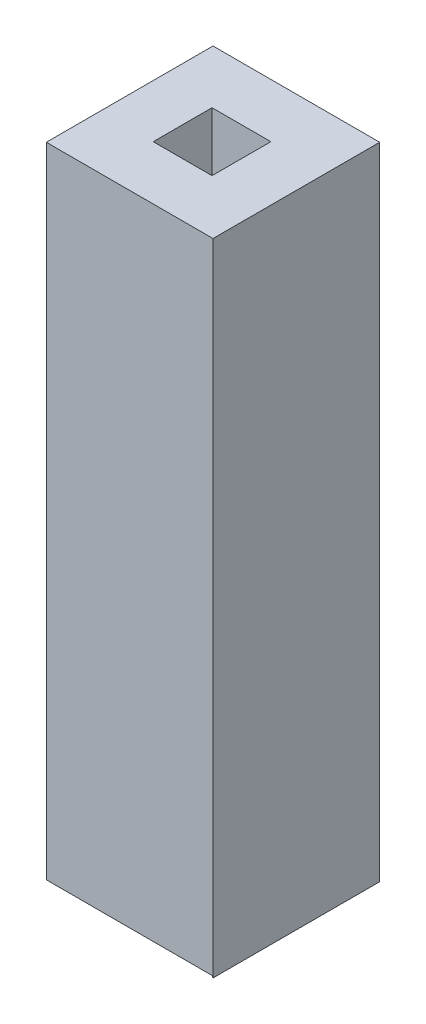
from build123d import *

# Parameters (mm, degrees)
SKETCH1_W           = 2.83333
SKETCH1_H           = 2.83333
BOSS_EXTRUDE2_DEPTH = 11
SKETCH2_W           = 1
SKETCH2_H           = 1
CUT_EXTRUDE1_DEPTH  = 11


with BuildPart() as part:
    # Sketch1 → Boss-Extrude2 (new body)
    with BuildSketch(Plane(origin=(0, 0, 0), x_dir=(1, 0, 0), z_dir=(0, 1, 0))):
        with Locations((1.416665, 1.416665)):
            Rectangle(SKETCH1_W, SKETCH1_H)
    extrude(amount=BOSS_EXTRUDE2_DEPTH)

    # Sketch2 → Cut-Extrude1 (cut)
    with BuildSketch(Plane(origin=(0, 0, 0), x_dir=(-1, 0, 0), z_dir=(0, -1, 0))):
        with Locations((-1.4, 1.416665)):
            Rectangle(SKETCH2_W, SKETCH2_H)
    extrude(amount=-CUT_EXTRUDE1_DEPTH, mode=Mode.SUBTRACT)

    # Chamfer5
    # the kernel refuses this chamfer: 1.732050808, 1 mm, written as the material it takes off along each edge
    with BuildSketch(Plane(origin=(1.9, 0, -0.916665), x_dir=(0, -0.05789386240267139, 0.9983227437537926), z_dir=(-1, 0, 0)), Plane(origin=(0.9, 0, -0.916665), x_dir=(-0.9983227437537926, -0.0578938624026714, 0), z_dir=(0, 0, -1)), Plane(origin=(0.9, 0, -1.916665), x_dir=(0, -0.05789386240267139, -0.9983227437537926), z_dir=(1, 0, 0)), Plane(origin=(1.9, 0, -1.916665), x_dir=(0.9983227437537926, -0.05789386240267139, 0), z_dir=(0, 0, 1))) as chamfer5_piece_1:
        with BuildLine():
            Line((1.03637929, 0), (-0.138331657, 1.787039577))
            Line((-0.138331657, 1.787039577), (-0.172914571, 1.785034075))
            ThreePointArc((-0.172914571, 1.785034075), (-0.086457286, 0.892517037), (-0.034582914, -0.002005502))
            Line((-0.034582914, -0.002005502), (0.002005502, -0.034582914))
            ThreePointArc((0.002005502, -0.034582914), (0.518458331, -0.004633232), (1.038384792, -0.034582914))
            Line((1.038384792, -0.034582914), (1.03637929, 0))
        make_face()
    extrude(amount=1, mode=Mode.SUBTRACT)
    with BuildSketch(Plane(origin=(1.9, 0, -1.916665), x_dir=(0.9983227437537926, -0.05789386240267139, 0), z_dir=(0, 0, 1))) as chamfer5_piece_2a_section:
        with BuildLine():
            Line((1.03637929, 0), (-0.138331657, 1.787039577))
            Line((-0.138331657, 1.787039577), (-0.172914571, 1.785034075))
            ThreePointArc((-0.172914571, 1.785034075), (-0.086457286, 0.892517037), (-0.034582914, -0.002005502))
            Line((-0.034582914, -0.002005502), (0.002005502, -0.034582914))
            ThreePointArc((0.002005502, -0.034582914), (0.518458331, -0.004633232), (1.038384792, -0.034582914))
            Line((1.038384792, -0.034582914), (1.03637929, 0))
        make_face()
    chamfer5_piece_2a = extrude(amount=5.480963971, mode=Mode.PRIVATE)
    chamfer5_piece_2a = split(chamfer5_piece_2a, bisect_by=Plane(origin=(2.220669895, 0.580899134, -0.916665), z_dir=(0, 0, 1)), keep=Keep.TOP, mode=Mode.PRIVATE)
    with BuildSketch(Plane(origin=(6.380963971, 0, -0.916665), x_dir=(0, -0.05789386240267139, 0.9983227437537926), z_dir=(-1, 0, 0))) as chamfer5_piece_2b_section:
        with BuildLine():
            Line((1.03637929, 0), (-0.138331657, 1.787039577))
            Line((-0.138331657, 1.787039577), (-0.172914571, 1.785034075))
            ThreePointArc((-0.172914571, 1.785034075), (-0.086457286, 0.892517037), (-0.034582914, -0.002005502))
            Line((-0.034582914, -0.002005502), (0.002005502, -0.034582914))
            ThreePointArc((0.002005502, -0.034582914), (0.518458331, -0.004633232), (1.038384792, -0.034582914))
            Line((1.038384792, -0.034582914), (1.03637929, 0))
        make_face()
    chamfer5_piece_2b = extrude(amount=5.480963971, mode=Mode.PRIVATE)
    chamfer5_piece_2b = split(chamfer5_piece_2b, bisect_by=Plane(origin=(1.9, 0.580899134, -0.595995105), z_dir=(1, 0, 0)), keep=Keep.TOP, mode=Mode.PRIVATE)
    chamfer5_piece_2 = chamfer5_piece_2a & chamfer5_piece_2b
    add(chamfer5_piece_2, mode=Mode.SUBTRACT)
    with BuildSketch(Plane(origin=(0.9, 0, 3.564298971), x_dir=(-0.9983227437537926, -0.0578938624026714, 0), z_dir=(0, 0, -1))) as chamfer5_piece_3a_section:
        with BuildLine():
            Line((1.03637929, 0), (-0.138331657, 1.787039577))
            Line((-0.138331657, 1.787039577), (-0.172914571, 1.785034075))
            ThreePointArc((-0.172914571, 1.785034075), (-0.086457286, 0.892517037), (-0.034582914, -0.002005502))
            Line((-0.034582914, -0.002005502), (0.002005502, -0.034582914))
            ThreePointArc((0.002005502, -0.034582914), (0.518458331, -0.004633232), (1.038384792, -0.034582914))
            Line((1.038384792, -0.034582914), (1.03637929, 0))
        make_face()
    chamfer5_piece_3a = extrude(amount=5.480963971, mode=Mode.PRIVATE)
    chamfer5_piece_3a = split(chamfer5_piece_3a, bisect_by=Plane(origin=(0.579330105, 0.580899134, -0.916665), z_dir=(0, 0, 1)), keep=Keep.TOP, mode=Mode.PRIVATE)
    with BuildSketch(Plane(origin=(1.9, 0, -0.916665), x_dir=(0, -0.05789386240267139, 0.9983227437537926), z_dir=(-1, 0, 0))) as chamfer5_piece_3b_section:
        with BuildLine():
            Line((1.03637929, 0), (-0.138331657, 1.787039577))
            Line((-0.138331657, 1.787039577), (-0.172914571, 1.785034075))
            ThreePointArc((-0.172914571, 1.785034075), (-0.086457286, 0.892517037), (-0.034582914, -0.002005502))
            Line((-0.034582914, -0.002005502), (0.002005502, -0.034582914))
            ThreePointArc((0.002005502, -0.034582914), (0.518458331, -0.004633232), (1.038384792, -0.034582914))
            Line((1.038384792, -0.034582914), (1.03637929, 0))
        make_face()
    chamfer5_piece_3b = extrude(amount=5.480963971, mode=Mode.PRIVATE)
    chamfer5_piece_3b = split(chamfer5_piece_3b, bisect_by=Plane(origin=(0.9, 0.580899134, -0.595995105), z_dir=(-1, 0, 0)), keep=Keep.TOP, mode=Mode.PRIVATE)
    chamfer5_piece_3 = chamfer5_piece_3a & chamfer5_piece_3b
    add(chamfer5_piece_3, mode=Mode.SUBTRACT)
    with BuildSketch(Plane(origin=(-3.580963971, 0, -1.916665), x_dir=(0, -0.05789386240267139, -0.9983227437537926), z_dir=(1, 0, 0))) as chamfer5_piece_4a_section:
        with BuildLine():
            Line((1.03637929, 0), (-0.138331657, 1.787039577))
            Line((-0.138331657, 1.787039577), (-0.172914571, 1.785034075))
            ThreePointArc((-0.172914571, 1.785034075), (-0.086457286, 0.892517037), (-0.034582914, -0.002005502))
            Line((-0.034582914, -0.002005502), (0.002005502, -0.034582914))
            ThreePointArc((0.002005502, -0.034582914), (0.518458331, -0.004633232), (1.038384792, -0.034582914))
            Line((1.038384792, -0.034582914), (1.03637929, 0))
        make_face()
    chamfer5_piece_4a = extrude(amount=5.480963971, mode=Mode.PRIVATE)
    chamfer5_piece_4a = split(chamfer5_piece_4a, bisect_by=Plane(origin=(0.9, 0.580899134, -2.237334895), z_dir=(-1, 0, 0)), keep=Keep.TOP, mode=Mode.PRIVATE)
    with BuildSketch(Plane(origin=(0.9, 0, -0.916665), x_dir=(-0.9983227437537926, -0.0578938624026714, 0), z_dir=(0, 0, -1))) as chamfer5_piece_4b_section:
        with BuildLine():
            Line((1.03637929, 0), (-0.138331657, 1.787039577))
            Line((-0.138331657, 1.787039577), (-0.172914571, 1.785034075))
            ThreePointArc((-0.172914571, 1.785034075), (-0.086457286, 0.892517037), (-0.034582914, -0.002005502))
            Line((-0.034582914, -0.002005502), (0.002005502, -0.034582914))
            ThreePointArc((0.002005502, -0.034582914), (0.518458331, -0.004633232), (1.038384792, -0.034582914))
            Line((1.038384792, -0.034582914), (1.03637929, 0))
        make_face()
    chamfer5_piece_4b = extrude(amount=5.480963971, mode=Mode.PRIVATE)
    chamfer5_piece_4b = split(chamfer5_piece_4b, bisect_by=Plane(origin=(0.579330105, 0.580899134, -1.916665), z_dir=(0, 0, -1)), keep=Keep.TOP, mode=Mode.PRIVATE)
    chamfer5_piece_4 = chamfer5_piece_4a & chamfer5_piece_4b
    add(chamfer5_piece_4, mode=Mode.SUBTRACT)
    with BuildSketch(Plane(origin=(1.9, 0, -6.397628971), x_dir=(0.9983227437537926, -0.05789386240267139, 0), z_dir=(0, 0, 1))) as chamfer5_piece_5a_section:
        with BuildLine():
            Line((1.03637929, 0), (-0.138331657, 1.787039577))
            Line((-0.138331657, 1.787039577), (-0.172914571, 1.785034075))
            ThreePointArc((-0.172914571, 1.785034075), (-0.086457286, 0.892517037), (-0.034582914, -0.002005502))
            Line((-0.034582914, -0.002005502), (0.002005502, -0.034582914))
            ThreePointArc((0.002005502, -0.034582914), (0.518458331, -0.004633232), (1.038384792, -0.034582914))
            Line((1.038384792, -0.034582914), (1.03637929, 0))
        make_face()
    chamfer5_piece_5a = extrude(amount=5.480963971, mode=Mode.PRIVATE)
    chamfer5_piece_5a = split(chamfer5_piece_5a, bisect_by=Plane(origin=(2.220669895, 0.580899134, -1.916665), z_dir=(0, 0, -1)), keep=Keep.TOP, mode=Mode.PRIVATE)
    with BuildSketch(Plane(origin=(0.9, 0, -1.916665), x_dir=(0, -0.05789386240267139, -0.9983227437537926), z_dir=(1, 0, 0))) as chamfer5_piece_5b_section:
        with BuildLine():
            Line((1.03637929, 0), (-0.138331657, 1.787039577))
            Line((-0.138331657, 1.787039577), (-0.172914571, 1.785034075))
            ThreePointArc((-0.172914571, 1.785034075), (-0.086457286, 0.892517037), (-0.034582914, -0.002005502))
            Line((-0.034582914, -0.002005502), (0.002005502, -0.034582914))
            ThreePointArc((0.002005502, -0.034582914), (0.518458331, -0.004633232), (1.038384792, -0.034582914))
            Line((1.038384792, -0.034582914), (1.03637929, 0))
        make_face()
    chamfer5_piece_5b = extrude(amount=5.480963971, mode=Mode.PRIVATE)
    chamfer5_piece_5b = split(chamfer5_piece_5b, bisect_by=Plane(origin=(1.9, 0.580899134, -2.237334895), z_dir=(1, 0, 0)), keep=Keep.TOP, mode=Mode.PRIVATE)
    chamfer5_piece_5 = chamfer5_piece_5a & chamfer5_piece_5b
    add(chamfer5_piece_5, mode=Mode.SUBTRACT)


solid = part.part
